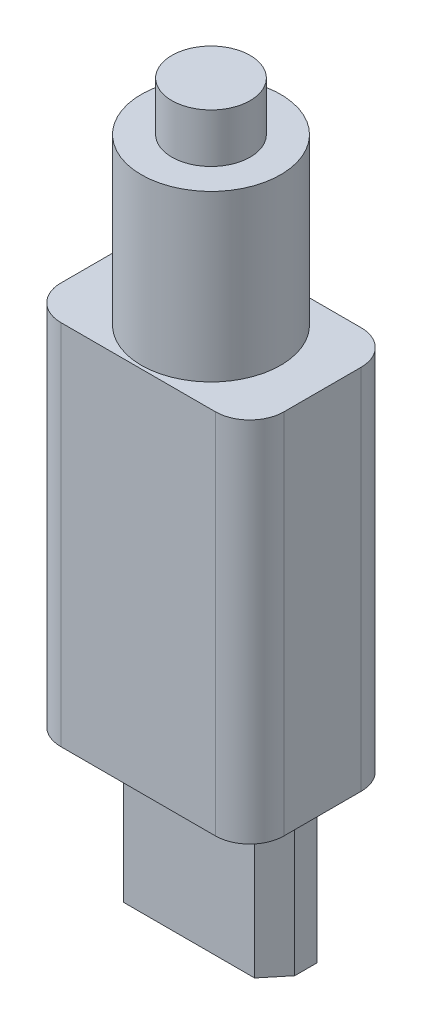
from build123d import *

# Parameters (mm, degrees)
BOSS_EXTRUDE1_DEPTH = 6.3
SKETCH2_W           = 9.11
SKETCH2_H           = 5.95
BOSS_EXTRUDE2_DEPTH = 15
FILLET1_R           = 1.4
SKETCH4_R           = 2.845
BOSS_EXTRUDE3_DEPTH = 6.74
SKETCH5_R           = 1.6
BOSS_EXTRUDE4_DEPTH = 2


with BuildPart() as part:
    # Sketch1 → Boss-Extrude1 (new body)
    with BuildSketch(Plane(origin=(0, 0, 0), x_dir=(1, 0, 0), z_dir=(0, 1, 0))):
        Polygon((-3.42, 0), (-2.68, -0.9), (2.68, -0.9), (3.42, 0), (3.42, 0.9), (-3.42, 0.9), align=None)
    extrude(amount=BOSS_EXTRUDE1_DEPTH)

    # Sketch2 → Boss-Extrude2 (add)
    with BuildSketch(Plane(origin=(0, 6.3, 0), x_dir=(1, 0, 0), z_dir=(0, 1, 0))):
        Rectangle(SKETCH2_W, SKETCH2_H)
    extrude(amount=BOSS_EXTRUDE2_DEPTH)

    # Fillet1
    fillet1_edges = [part.edges().sort_by_distance(p)[0] for p in [
        (4.555, 13.8, -2.975),
        (-4.555, 13.8, -2.975),
        (-4.555, 13.8, 2.975),
        (4.555, 13.8, 2.975),
    ]]
    fillet(fillet1_edges, radius=FILLET1_R)

    # Sketch4 → Boss-Extrude3 (add)
    with BuildSketch(Plane(origin=(0, 21.3, 0), x_dir=(1, 0, 0), z_dir=(0, 1, 0))):
        Circle(SKETCH4_R)
    extrude(amount=BOSS_EXTRUDE3_DEPTH)

    # Sketch5 → Boss-Extrude4 (add)
    with BuildSketch(Plane(origin=(0, 28.04, 0), x_dir=(1, 0, 0), z_dir=(0, 1, 0))):
        Circle(SKETCH5_R)
    extrude(amount=BOSS_EXTRUDE4_DEPTH)


solid = part.part
